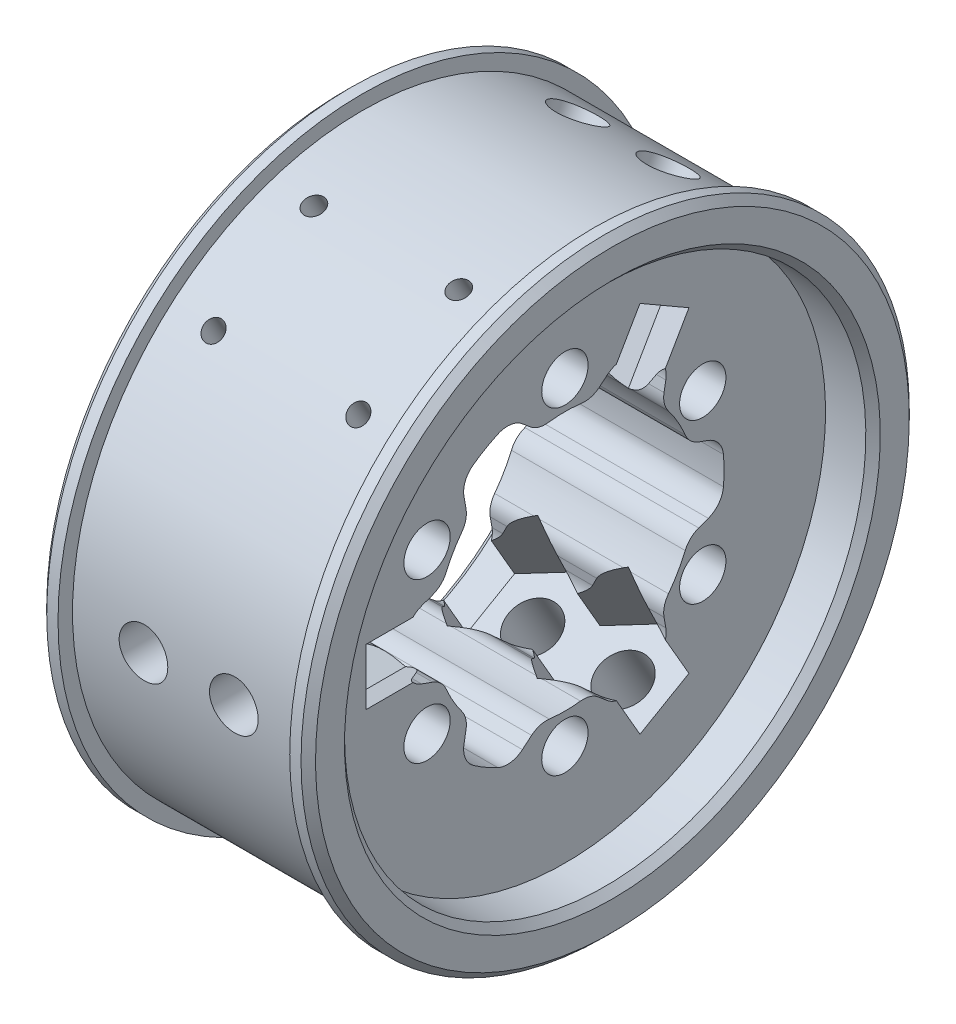
from build123d import *

# Parameters (mm, degrees)
SKETCH2_R           = 2.54
CUT_EXTRUDE3_DEPTH  = 56.595909099
SKETCH3_R           = 28.575
CUT_EXTRUDE4_DEPTH  = 5.207
SKETCH4_R           = 22.86
CUT_EXTRUDE5_DEPTH  = 5.207
CHAMFER1_SIZE       = 0.79375
CUT_EXTRUDE6_START  = -5.08
CUT_EXTRUDE6_DEPTH  = 9.525
SKETCH10_R          = 2.667
CUT_EXTRUDE9_DEPTH  = 67.117778807
CIRPATTERN2_COUNT   = 3
SKETCH11_R          = 1.0922
CUT_EXTRUDE10_DEPTH = 67.761937332
CIRPATTERN3_COUNT   = 3


with BuildPart() as part:
    # Sketch1 → Revolve1 (revolve)
    with BuildSketch(Plane.XY):
        Polygon((0, 0), (0, 31.75), (12.7, 31.75), (12.7, 33.3375), (14.732, 33.3375), (14.732, 0), align=None)
    revolve1 = revolve(axis=Axis((14.732, 0, 0), (-1, 0, 0)))

    # Mirror3: Revolve1 across plane
    add(revolve1.mirror(Plane.ZY))

    # Sketch2 → Cut-Extrude3 (cut, through all)
    with BuildSketch(Plane(origin=(14.732, 0, 0), x_dir=(0, 0, -1), z_dir=(1, 0, 0))):
        with Locations((0, 17.4498)):
            Circle(SKETCH2_R)
        with Locations((15.111970091, 8.7249)):
            Circle(SKETCH2_R)
        with Locations((15.111970091, -8.7249)):
            Circle(SKETCH2_R)
        with Locations((0, -17.4498)):
            Circle(SKETCH2_R)
        with Locations((-15.111970091, -8.7249)):
            Circle(SKETCH2_R)
        with Locations((-15.111970091, 8.7249)):
            Circle(SKETCH2_R)
        with BuildLine():
            Line((14.665568358, 4.08236111), (15.720738661, 3.698310528))
            ThreePointArc((15.720738661, 3.698310528), (16.866499311, 2.858560348), (17.382162096, 1.534913975))
            ThreePointArc((17.382162096, 1.534913975), (17.4498, 0), (17.382162096, -1.534913975))
            ThreePointArc((17.382162096, -1.534913975), (16.866499311, -2.858560348), (15.720738661, -3.698310528))
            Line((15.720738661, -3.698310528), (14.665568358, -4.08236111))
            ThreePointArc((14.665568358, -4.08236111), (13.779603056, -4.632705397), (13.189499594, -5.492700312))
            ThreePointArc((13.189499594, -5.492700312), (12.373337957, -7.14375), (11.351567802, -8.676091556))
            ThreePointArc((11.351567802, -8.676091556), (10.90184209, -9.617133602), (10.868212608, -10.659574204))
            Line((10.868212608, -10.659574204), (11.063200199, -11.765403783))
            ThreePointArc((11.063200199, -11.765403783), (10.908835536, -13.177536702), (10.020355543, -14.28593696))
            ThreePointArc((10.020355543, -14.28593696), (8.7249, -15.111970091), (7.361806553, -15.820850935))
            ThreePointArc((7.361806553, -15.820850935), (5.957663775, -16.03609705), (4.657538462, -15.46371431))
            Line((4.657538462, -15.46371431), (3.648569587, -14.617088899))
            ThreePointArc((3.648569587, -14.617088899), (2.738575306, -14.127821336), (1.709006412, -14.041448709))
            ThreePointArc((1.709006412, -14.041448709), (0, -14.145069274), (-1.709006412, -14.041448709))
            ThreePointArc((-1.709006412, -14.041448709), (-2.738575306, -14.127821336), (-3.648569587, -14.617088899))
            Line((-3.648569587, -14.617088899), (-4.657538462, -15.46371431))
            ThreePointArc((-4.657538462, -15.46371431), (-5.957663775, -16.03609705), (-7.361806553, -15.820850935))
            ThreePointArc((-7.361806553, -15.820850935), (-8.7249, -15.111970091), (-10.020355543, -14.28593696))
            ThreePointArc((-10.020355543, -14.28593696), (-10.908835536, -13.177536702), (-11.063200199, -11.765403783))
            Line((-11.063200199, -11.765403783), (-10.834485523, -10.468298399))
            ThreePointArc((-10.834485523, -10.468298399), (-10.865764524, -9.435586453), (-11.305748082, -8.500767323))
            ThreePointArc((-11.305748082, -8.500767323), (-12.249989329, -7.072534637), (-13.014754494, -5.540681386))
            ThreePointArc((-13.014754494, -5.540681386), (-13.60433983, -4.692234882), (-14.483055109, -4.1487905))
            Line((-14.483055109, -4.1487905), (-15.720738661, -3.698310528))
            ThreePointArc((-15.720738661, -3.698310528), (-16.866499311, -2.858560348), (-17.382162096, -1.534913975))
            ThreePointArc((-17.382162096, -1.534913975), (-17.4498, 0), (-17.382162096, 1.534913975))
            ThreePointArc((-17.382162096, 1.534913975), (-16.866499311, 2.858560348), (-15.720738661, 3.698310528))
            Line((-15.720738661, 3.698310528), (-14.483055109, 4.1487905))
            ThreePointArc((-14.483055109, 4.1487905), (-13.60433983, 4.692234882), (-13.014754494, 5.540681386))
            ThreePointArc((-13.014754494, 5.540681386), (-12.249989329, 7.072534637), (-11.305748082, 8.500767323))
            ThreePointArc((-11.305748082, 8.500767323), (-10.865764524, 9.435586453), (-10.834485523, 10.468298399))
            Line((-10.834485523, 10.468298399), (-11.063200199, 11.765403783))
            ThreePointArc((-11.063200199, 11.765403783), (-10.908835536, 13.177536702), (-10.020355543, 14.28593696))
            ThreePointArc((-10.020355543, 14.28593696), (-8.7249, 15.111970091), (-7.361806553, 15.820850935))
            ThreePointArc((-7.361806553, 15.820850935), (-5.957663775, 16.03609705), (-4.657538462, 15.46371431))
            Line((-4.657538462, 15.46371431), (-3.79735575, 14.741935314))
            ThreePointArc((-3.79735575, 14.741935314), (-2.877760966, 14.249838999), (-1.837931792, 14.168791867))
            ThreePointArc((-1.837931792, 14.168791867), (0, 14.2875), (1.837931792, 14.168791867))
            ThreePointArc((1.837931792, 14.168791867), (2.877760966, 14.249838999), (3.79735575, 14.741935314))
            Line((3.79735575, 14.741935314), (4.657538462, 15.46371431))
            ThreePointArc((4.657538462, 15.46371431), (5.957663775, 16.03609705), (7.361806553, 15.820850935))
            ThreePointArc((7.361806553, 15.820850935), (8.7249, 15.111970091), (10.020355543, 14.28593696))
            ThreePointArc((10.020355543, 14.28593696), (10.908835536, 13.177536702), (11.063200199, 11.765403783))
            Line((11.063200199, 11.765403783), (10.868212608, 10.659574204))
            ThreePointArc((10.868212608, 10.659574204), (10.90184209, 9.617133602), (11.351567802, 8.676091556))
            ThreePointArc((11.351567802, 8.676091556), (12.373337957, 7.14375), (13.189499594, 5.492700312))
            ThreePointArc((13.189499594, 5.492700312), (13.779603056, 4.632705397), (14.665568358, 4.08236111))
        make_face()
    extrude(amount=-CUT_EXTRUDE3_DEPTH, mode=Mode.SUBTRACT)

    # Sketch3 → Cut-Extrude4 (cut)
    with BuildSketch(Plane(origin=(14.732, 0, 0), x_dir=(0, 0, -1), z_dir=(1, 0, 0))):
        Circle(SKETCH3_R)
    extrude(amount=-CUT_EXTRUDE4_DEPTH, mode=Mode.SUBTRACT)

    # Sketch4 → Cut-Extrude5 (cut)
    with BuildSketch(Plane.ZY.offset(14.732)):
        Circle(SKETCH4_R)
    extrude(amount=-CUT_EXTRUDE5_DEPTH, mode=Mode.SUBTRACT)

    # Chamfer1
    chamfer1_edges = [part.edges().sort_by_distance(p)[0] for p in [
        (-14.732, 0, -22.86),
        (-14.732, -33.3375, 0),
        (14.732, -33.3375, 0),
        (14.732, 0, 28.575),
    ]]
    chamfer(chamfer1_edges, length=CHAMFER1_SIZE)

    # Sketch7 → Cut-Extrude6 (cut)
    with BuildSketch(Plane.XY.offset(17.382162096).offset(CUT_EXTRUDE6_START)):
        Polygon((-4.92125, 5.682570024), (-9.8425, 2.841285012), (-9.8425, -2.841285012), (-4.92125, -5.682570024), (0, -2.841285012), (4.98475, -5.719231767), (9.93775, -2.859615883), (9.93775, 2.859615883), (4.98475, 5.719231767), (0, 2.841285012), align=None)
    cut_extrude6 = extrude(amount=CUT_EXTRUDE6_DEPTH, mode=Mode.SUBTRACT)

    # Sketch10 → Cut-Extrude9 (cut, through all)
    with BuildSketch(Plane(origin=(0, 0, 21.827162096), x_dir=(-1, 0, 0), z_dir=(0, 0, -1))):
        with Locations((-4.98475, 0)):
            Circle(SKETCH10_R)
        with Locations((4.92125, 0)):
            Circle(SKETCH10_R)
    cut_extrude9 = extrude(amount=-CUT_EXTRUDE9_DEPTH, mode=Mode.SUBTRACT)

    # CirPattern2: Cut-Extrude6, Cut-Extrude9 ×3 about axis
    cirpattern2_axis = Axis((12.7, 0, 0), (1, 0, 0))
    add([cut_extrude6.rotate(cirpattern2_axis, i * 360 / CIRPATTERN2_COUNT) for i in range(1, CIRPATTERN2_COUNT)], mode=Mode.SUBTRACT)
    add([cut_extrude9.rotate(cirpattern2_axis, i * 360 / CIRPATTERN2_COUNT) for i in range(1, CIRPATTERN2_COUNT)], mode=Mode.SUBTRACT)

    # Sketch11 → Cut-Extrude10 (cut, through all)
    with BuildSketch(Plane(origin=(0, -21.287249995, -2.106274352), x_dir=(1, 0, 0), z_dir=(0, 0.8660254037844386, -0.5000000000000002))):
        with Locations((-7.9375, -6.117712094)):
            Circle(SKETCH11_R)
        with Locations((-7.9375, -18.817712094)):
            Circle(SKETCH11_R)
        with Locations((7.9375, -18.817712094)):
            Circle(SKETCH11_R)
        with Locations((7.9375, -6.117712094)):
            Circle(SKETCH11_R)
    cut_extrude10 = extrude(amount=-CUT_EXTRUDE10_DEPTH, mode=Mode.SUBTRACT)

    # CirPattern3: Cut-Extrude10 ×3 about axis
    cirpattern3_axis = Axis((-12.7, 0, 0), (1, 0, 0))
    for i in range(1, CIRPATTERN3_COUNT):
        add(cut_extrude10.rotate(cirpattern3_axis, i * 360 / CIRPATTERN3_COUNT), mode=Mode.SUBTRACT)


solid = part.part
